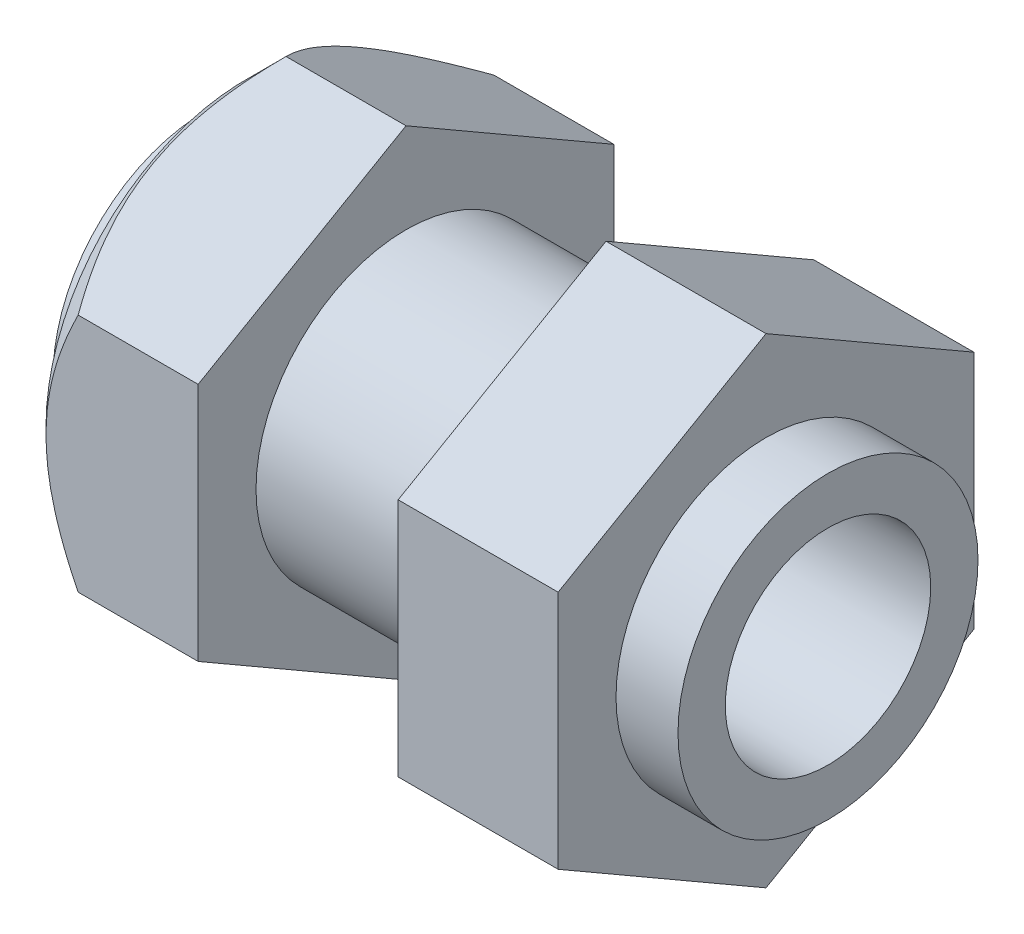
from build123d import *

# Parameters (mm, degrees)
CHANFREIN1_SIZE         = 2
ESQUISSE2_OUTSIDE_W     = 35.65
ESQUISSE2_OUTSIDE_H     = 35.651
ENL_V_MAT_EXTRU_1_DEPTH = 205.103724684


with BuildPart() as part:
    # Esquisse1 → Révolution1 (revolve)
    with BuildSketch(Plane(origin=(0, 0, 170), x_dir=(-1, 0, 0), z_dir=(0, 0, -1))):
        Polygon((429.956854634, -62.926493226), (421.956854634, -62.926493226), (421.956854634, -67.610839698), (418.857974896, -67.610839698), (418.857974896, -69.974099541), (424.956854634, -69.974099541), (444.956854634, -69.974099541), (449.949312551, -69.974099541), (449.949312551, -67.45672103), (447.956854634, -67.45672103), (447.956854634, -63.110839698), (439.956854634, -63.110839698), (439.956854634, -67.610839698), (429.956854634, -67.610839698), align=None)
    revolve(axis=Axis((-429.956854634, -75.110839698, 170), (-1, 0, 0)))

    # Chanfrein1
    chanfrein1_edges = [part.edges().sort_by_distance(p)[0] for p in [
        (-447.956854634, -87.110839698, 170),
    ]]
    chamfer(chanfrein1_edges, length=CHANFREIN1_SIZE)

    # Esquisse2 outside → Enlèv. mat.-Extru.1 (cut, through all)
    with BuildSketch(Plane.ZY.offset(447.956854634)):
        with Locations((170, -75.1105)):
            Rectangle(ESQUISSE2_OUTSIDE_W, ESQUISSE2_OUTSIDE_H)
        Polygon((170, -63.110839698), (159.607695155, -69.110839698), (159.607695155, -81.110839698), (170, -87.110839698), (180.392304845, -81.110839698), (180.392304845, -69.110839698), align=None, mode=Mode.SUBTRACT)
    extrude(amount=-ENL_V_MAT_EXTRU_1_DEPTH, mode=Mode.SUBTRACT)


solid = part.part
